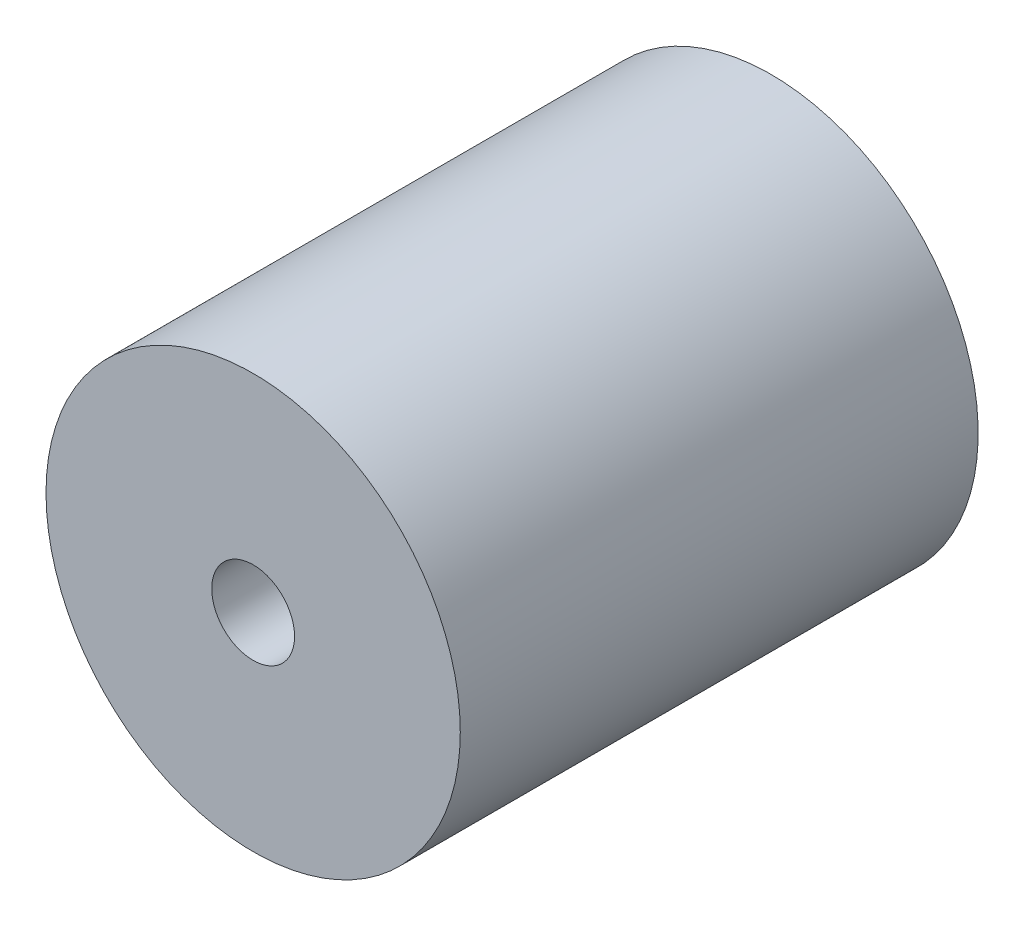
from build123d import *

# Parameters (mm, degrees)
SKETCH1_R           = 10
SKETCH1_R_2         = 2
BOSS_EXTRUDE1_DEPTH = 10
BOSS_EXTRUDE3_START = 5
SKETCH4_R           = 10
BOSS_EXTRUDE3_DEPTH = 5
BOSS_EXTRUDE4_START = 10
SKETCH5_R           = 10
SKETCH5_R_2         = 2
BOSS_EXTRUDE4_DEPTH = 10


with BuildPart() as part:
    # Sketch1 → Boss-Extrude1 (new body)
    with BuildSketch(Plane.XY):
        Circle(SKETCH1_R)
        Circle(SKETCH1_R_2, mode=Mode.SUBTRACT)
    extrude(amount=BOSS_EXTRUDE1_DEPTH)

    # Sketch4 → Boss-Extrude3 (add)
    with BuildSketch(Plane(origin=(0, 0, 0), x_dir=(-1, 0, 0), z_dir=(0, 0, -1)).offset(BOSS_EXTRUDE3_START)):
        Circle(SKETCH4_R)
    extrude(amount=-BOSS_EXTRUDE3_DEPTH)

    # Sketch5 → Boss-Extrude4 (add)
    with BuildSketch(Plane(origin=(0, 0, -5), x_dir=(-1, 0, 0), z_dir=(0, 0, -1)).offset(BOSS_EXTRUDE4_START)):
        Circle(SKETCH5_R)
        Circle(SKETCH5_R_2, mode=Mode.SUBTRACT)
    extrude(amount=-BOSS_EXTRUDE4_DEPTH)


solid = part.part
